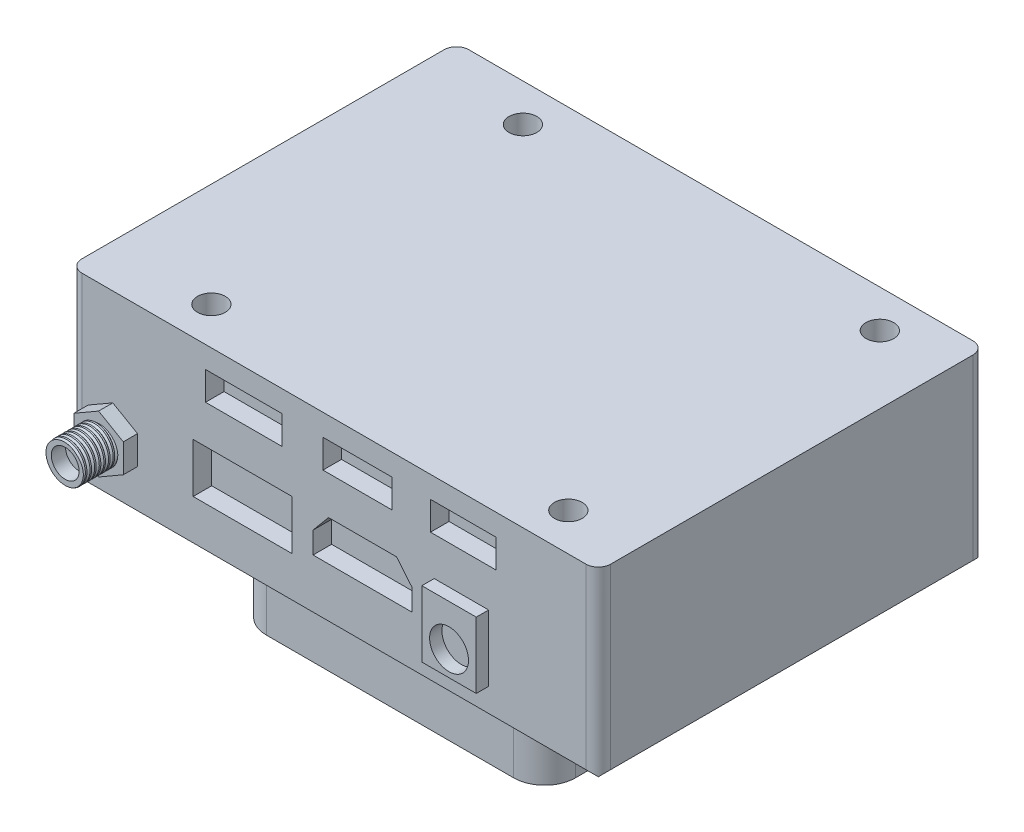
from build123d import *

# Parameters (mm, degrees)
SKETCH1_W           = 85.55
SKETCH1_H           = 62.6
BOSS_EXTRUDE1_DEPTH = 31.5
SKETCH2_R           = 2.25
CUT_EXTRUDE1_DEPTH  = 31.5
SKETCH3_W           = 16
SKETCH3_H           = 8
SKETCH3_W_2         = 12.4
SKETCH3_H_2         = 4.6
SKETCH3_W_3         = 11.2
SKETCH3_W_4         = 10.6
CUT_EXTRUDE2_DEPTH  = 3
SKETCH4_W           = 8.8
SKETCH4_H           = 10.7
SKETCH4_R           = 3.15
BOSS_EXTRUDE2_DEPTH = 2
BOSS_EXTRUDE3_DEPTH = 2.3
SKETCH6_R           = 3.11
BOSS_EXTRUDE4_DEPTH = 5.4
CUT_SWEEP1_PITCH    = 0.75
CUT_SWEEP1_FROM     = 0
SKETCH13_R          = 2.25
CUT_EXTRUDE3_DEPTH  = 2.3
CUT_EXTRUDE5_DEPTH  = 2.7
CHAMFER1_SIZE       = 2.7
CHAMFER3_SIZE       = 2.7
SKETCH15_R          = 1.75
CUT_EXTRUDE6_DEPTH  = 3
SKETCH17_R          = 3
SKETCH17_R_2        = 23.875
BOSS_EXTRUDE5_DEPTH = 10.6
BOSS_EXTRUDE6_DEPTH = 2
SKETCH21_W          = 11.7
SKETCH21_H          = 4.7
SKETCH21_W_2        = 9.3
SKETCH21_W_3        = 12.7
SKETCH21_H_2        = 2
CUT_EXTRUDE7_DEPTH  = 3
SKETCH22_W          = 10.7
SKETCH22_H          = 4.4
SKETCH22_W_2        = 8.1
CUT_EXTRUDE8_DEPTH  = 3
FILLET1_R           = 2


with BuildPart() as part:
    # Sketch1 → Boss-Extrude1 (new body)
    with BuildSketch(Plane(origin=(0, 0, 0), x_dir=(1, 0, 0), z_dir=(0, 1, 0))):
        Rectangle(SKETCH1_W, SKETCH1_H)
    extrude(amount=BOSS_EXTRUDE1_DEPTH)

    # Sketch2 → Cut-Extrude1 (cut)
    with BuildSketch(Plane(origin=(0, 31.5, 0), x_dir=(1, 0, 0), z_dir=(0, 1, 0))):
        with Locations(Location((-25.925, 25.2, 0), (0, 0, 270))):
            Circle(SKETCH2_R)
        with Locations(Location((31.825, 25.2, 0), (0, 0, 270))):
            Circle(SKETCH2_R)
        with Locations(Location((31.825, -25.2, 0), (0, 0, 270))):
            Circle(SKETCH2_R)
        with Locations(Location((-25.925, -25.2, 0), (0, 0, 270))):
            Circle(SKETCH2_R)
    extrude(amount=-CUT_EXTRUDE1_DEPTH, mode=Mode.SUBTRACT)

    # Sketch3 → Cut-Extrude2 (cut)
    with BuildSketch(Plane.XY.offset(31.3)):
        with Locations((-14.775, 13.2)):
            Rectangle(SKETCH3_W, SKETCH3_H)
        with Locations((-14.575, 25.7)):
            Rectangle(SKETCH3_W_2, SKETCH3_H_2)
        Polygon((-3.375, 10.7), (-3.375, 14.2), (-0.874607038, 17.2), (10.125392962, 17.2), (12.625, 14.2), (12.625, 10.7), align=None)
        with Locations((3.825, 25.7)):
            Rectangle(SKETCH3_W_3, SKETCH3_H_2)
        with Locations((20.925, 25.7)):
            Rectangle(SKETCH3_W_4, SKETCH3_H_2)
    extrude(amount=-CUT_EXTRUDE2_DEPTH, mode=Mode.SUBTRACT)

    # Sketch4 → Boss-Extrude2 (add)
    with BuildSketch(Plane.XY.offset(31.3)):
        with Locations((20.625, 11.85)):
            Rectangle(SKETCH4_W, SKETCH4_H)
        with Locations((20.625, 10.5)):
            Circle(SKETCH4_R, mode=Mode.SUBTRACT)
    extrude(amount=BOSS_EXTRUDE2_DEPTH)

    # Sketch5 → Boss-Extrude3 (add)
    with BuildSketch(Plane.XY.offset(31.3)):
        Polygon((-35.775, 6.581197846), (-31.775, 8.890598923), (-31.775, 13.509401077), (-35.775, 15.818802154), (-39.775, 13.509401077), (-39.775, 8.890598923), align=None)
    boss_extrude3 = extrude(amount=BOSS_EXTRUDE3_DEPTH)

    # Sketch6 → Boss-Extrude4 (add)
    with BuildSketch(Plane.XY.offset(33.6)):
        with Locations(Location((-35.775, 11.2, 0), (0, 0, 180))):
            Circle(SKETCH6_R)
    boss_extrude4 = extrude(amount=BOSS_EXTRUDE4_DEPTH)

    # Cut-Sweep1: arcs per turn and ends read off the stored shape
    # Cut-Sweep1: the profile of Sketch10 profile screwed along a left-hand helix through 10 turns, 8 arcs to a turn; built about Z, then put on its axis
    cut_sweep1_z = Axis((0, 0, 0), (0, 0, 1))
    cut_sweep1_corners = [(3.1103, 0, -0.75025), (3.1103, 0, -0.24975), (2.81, 0, -0.5)]
    with BuildLine(mode=Mode.PRIVATE) as cut_sweep1_profile:
        Line(cut_sweep1_corners[0], cut_sweep1_corners[1])
        Line(cut_sweep1_corners[1], cut_sweep1_corners[2])
        Line(cut_sweep1_corners[2], cut_sweep1_corners[0])
    cut_sweep1_cap = Face(cut_sweep1_profile.wire())
    cut_sweep1_turn_angles = [0, -22.5, -45, -67.5, -90, -112.5, -135, -157.5, -180, -202.5, -225, -247.5, -270, -292.5, -315, -337.5, -360]
    cut_sweep1_turn_weights = [1, 0.9238795325112867, 1, 0.9238795325112867, 1, 0.9238795325112867, 1, 0.9238795325112867, 1, 0.9238795325112867, 1, 0.9238795325112867, 1, 0.9238795325112867, 1, 0.9238795325112867, 1]
    cut_sweep1_turn_rails = [Edge.make_bspline([Vector(p[0], p[1], 0).rotate(cut_sweep1_z, cut_sweep1_turn_angles[k]) / cut_sweep1_turn_weights[k] + Vector(0, 0, p[2] + -CUT_SWEEP1_PITCH * cut_sweep1_turn_angles[k] / 360) for k in range(17)], [0, 0, 0, 1, 1, 2, 2, 3, 3, 4, 4, 5, 5, 6, 6, 7, 7, 8, 8, 8], 2, cut_sweep1_turn_weights) for p in cut_sweep1_corners]
    cut_sweep1_turn_sides = [Face.make_surface_from_curves(cut_sweep1_turn_rails[p[0]], cut_sweep1_turn_rails[p[1]]) for p in [(0, 1), (1, 2), (2, 0)]]
    cut_sweep1 = Plane(origin=(-35.775, 11.2, 33.6), x_dir=(1, 0, 0), z_dir=(0, 0, 1)) * split(Solid(Shell([*[p.moved(Location((0, 0, CUT_SWEEP1_PITCH * i))) for i in range(10) for p in cut_sweep1_turn_sides], cut_sweep1_cap, cut_sweep1_cap.rotate(cut_sweep1_z, -3600).moved(Location((0, 0, -CUT_SWEEP1_PITCH * -3600 / 360)))])), bisect_by=Plane.XY.offset(CUT_SWEEP1_FROM), keep=Keep.TOP, mode=Mode.PRIVATE)
    add(cut_sweep1, mode=Mode.SUBTRACT)

    # Sketch13 → Cut-Extrude3 (cut)
    with BuildSketch(Plane.XY.offset(39)):
        with Locations((-35.775, 11.2)):
            Circle(SKETCH13_R)
    cut_extrude3 = extrude(amount=-CUT_EXTRUDE3_DEPTH, mode=Mode.SUBTRACT)

    # Mirror1: Boss-Extrude3, Boss-Extrude4, Cut-Sweep1, Cut-Extrude3 across plane
    add(boss_extrude3.mirror(Plane.XY))
    add(boss_extrude4.mirror(Plane.XY))
    add(cut_sweep1.mirror(Plane.XY), mode=Mode.SUBTRACT)
    add(cut_extrude3.mirror(Plane.XY), mode=Mode.SUBTRACT)

    # Sketch14 → Cut-Extrude5 (cut)
    with BuildSketch(Plane.XZ):
        with BuildLine():
            Line((-36.175, 18), (-36.175, 24.7))
            Line((-36.175, 24.7), (-17.975, 24.7))
            Line((-17.975, 24.7), (-17.975, 22.99961536))
            ThreePointArc((-17.975, 22.99961536), (-16.975, 16.349999998), (-15.975, 22.99961536))
            Line((-15.975, 22.99961536), (-15.975, 24.7))
            Line((-15.975, 24.7), (21.525, 24.7))
            Line((21.525, 24.7), (21.525, 22.99961536))
            ThreePointArc((21.525, 22.99961536), (22.525, 16.349999998), (23.525, 22.99961536))
            Line((23.525, 22.99961536), (23.525, 24.7))
            Line((23.525, 24.7), (36.175, 24.7))
            Line((36.175, 24.7), (36.175, 19.5))
            Line((36.175, 19.5), (32.475, 19.5))
            ThreePointArc((32.475, 19.5), (30.353679656, 18.621320344), (29.475, 16.5))
            Line((29.475, 16.5), (29.475, -16.5))
            ThreePointArc((29.475, -16.5), (30.353679656, -18.621320344), (32.475, -19.5))
            Line((32.475, -19.5), (36.175, -19.5))
            Line((36.175, -19.5), (36.175, -24.7))
            Line((36.175, -24.7), (23.525, -24.7))
            Line((23.525, -24.7), (23.525, -22.999615364))
            ThreePointArc((23.525, -22.999615364), (22.525, -16.350000002), (21.525, -22.999615364))
            Line((21.525, -22.999615364), (21.525, -24.7))
            Line((21.525, -24.7), (-15.975, -24.7))
            Line((-15.975, -24.7), (-15.975, -22.999615364))
            ThreePointArc((-15.975, -22.999615364), (-16.975, -16.350000002), (-17.975, -22.999615364))
            Line((-17.975, -22.999615364), (-17.975, -24.7))
            Line((-17.975, -24.7), (-36.175, -24.7))
            Line((-36.175, -24.7), (-36.175, -18))
            Line((-36.175, -18), (-29.875, -18))
            ThreePointArc((-29.875, -18), (-27.753679656, -17.121320344), (-26.875, -15))
            Line((-26.875, -15), (-26.875, 15))
            ThreePointArc((-26.875, 15), (-27.753679656, 17.121320344), (-29.875, 18))
            Line((-29.875, 18), (-36.175, 18))
        make_face()
        with BuildLine():
            Line((-36.175, 16.5), (-36.175, 0.6))
            Line((-36.175, 0.6), (-28.875, 0.6))
            Line((-28.875, 0.6), (-28.875, 13.5))
            ThreePointArc((-28.875, 13.5), (-29.753679656, 15.621320344), (-31.875, 16.5))
            Line((-31.875, 16.5), (-36.175, 16.5))
        make_face()
        with BuildLine():
            Line((-36.175, -0.6), (-36.175, -16.5))
            Line((-36.175, -16.5), (-31.875, -16.5))
            ThreePointArc((-31.875, -16.5), (-29.753679656, -15.621320344), (-28.875, -13.5))
            Line((-28.875, -13.5), (-28.875, -0.6))
            Line((-28.875, -0.6), (-36.175, -0.6))
        make_face()
        with BuildLine():
            Line((36.175, 18), (33.975, 18))
            ThreePointArc((33.975, 18), (31.853679656, 17.121320344), (30.975, 15))
            Line((30.975, 15), (30.975, 0.6))
            Line((30.975, 0.6), (36.175, 0.6))
            Line((36.175, 0.6), (36.175, 18))
        make_face()
        with BuildLine():
            Line((36.175, -18), (33.975, -18))
            ThreePointArc((33.975, -18), (31.853679656, -17.121320344), (30.975, -15))
            Line((30.975, -15), (30.975, -0.6))
            Line((30.975, -0.6), (36.175, -0.6))
            Line((36.175, -0.6), (36.175, -18))
        make_face()
    extrude(amount=-CUT_EXTRUDE5_DEPTH, mode=Mode.SUBTRACT)

    # Chamfer1
    # the kernel refuses this chamfer: 4.080697596, 2.7, 2.255227871 mm, written as the material it adds along each edge
    with BuildSketch(Plane(origin=(-21.175197029, 2.7, -24.7), x_dir=(0, -1, 0), z_dir=(-1, 0, 0))) as chamfer1_piece_1_section:
        Polygon((CHAMFER1_SIZE, 0), (0, CHAMFER1_SIZE), (0, 0), align=None)
    chamfer1_piece_1 = extrude(amount=14.999802971, mode=Mode.PRIVATE)
    chamfer1_piece_1 = chamfer1_piece_1 - Plane(origin=(-25.925, 2.7, -25.2), x_dir=(0, 0, 1), z_dir=(0, 1, 0)) * Cylinder(2.25, 41, mode=Mode.PRIVATE)
    with BuildSketch(Plane(origin=(-11.031455932, 2.7, -24.7), x_dir=(0, -1, 0), z_dir=(-1, 0, 0))) as chamfer1_piece_2_section:
        Polygon((CHAMFER1_SIZE, 0), (0, CHAMFER1_SIZE), (0, 0), align=None)
    chamfer1_piece_2 = extrude(amount=19.643347038, mode=Mode.PRIVATE)
    chamfer1_piece_2 = chamfer1_piece_2 - Plane(origin=(-25.925, 2.7, -25.2), x_dir=(0, 0, 1), z_dir=(0, 1, 0)) * Cylinder(2.25, 51, mode=Mode.PRIVATE)
    with BuildSketch(Plane(origin=(36.574802971, 2.7, -24.7), x_dir=(0, -1, 0), z_dir=(-1, 0, 0))) as chamfer1_piece_3_section:
        Polygon((CHAMFER1_SIZE, 0), (0, CHAMFER1_SIZE), (0, 0), align=None)
    chamfer1_piece_3 = extrude(amount=19.993347038, mode=Mode.PRIVATE)
    chamfer1_piece_3 = chamfer1_piece_3 - Plane(origin=(31.825, 2.7, -25.2), x_dir=(0, 0, 1), z_dir=(0, 1, 0)) * Cylinder(2.25, 51, mode=Mode.PRIVATE)
    with BuildSketch(Plane(origin=(36.175, 2.7, -24.7), x_dir=(0, -1, 0), z_dir=(-1, 0, 0))) as chamfer1_piece_4_section:
        Polygon((CHAMFER1_SIZE, 0), (0, CHAMFER1_SIZE), (0, 0), align=None)
    chamfer1_piece_4 = extrude(amount=9.099802971, mode=Mode.PRIVATE)
    chamfer1_piece_4 = chamfer1_piece_4 - Plane(origin=(31.825, 2.7, -25.2), x_dir=(0, 0, 1), z_dir=(0, 1, 0)) * Cylinder(2.25, 29, mode=Mode.PRIVATE)
    with BuildSketch(Plane(origin=(36.175, -6.943544068, -24.7), x_dir=(-1, 0, 0), z_dir=(0, 1, 0))) as chamfer1_piece_5_section:
        Polygon((CHAMFER1_SIZE, 0), (0, CHAMFER1_SIZE), (0, 0), align=None)
    chamfer1_piece_5 = extrude(amount=16.587088135, mode=Mode.PRIVATE)
    chamfer1_piece_5 = chamfer1_piece_5 - Plane(origin=(31.825, -6.943544068, -25.2), x_dir=(0, 0, 1), z_dir=(0, 1, 0)) * Cylinder(2.25, 44, mode=Mode.PRIVATE)
    chamfer1_piece_5 = split(chamfer1_piece_5, bisect_by=Plane(origin=(36.175, -3.471772034, -28.171772034), z_dir=(0, 0.7071067811865475, -0.7071067811865477)), keep=Keep.TOP, mode=Mode.PRIVATE)
    with BuildSketch(Plane(origin=(27.075197029, 2.7, 24.7), x_dir=(0, -1, 0), z_dir=(1, 0, 0))) as chamfer1_piece_6_section:
        Polygon((CHAMFER1_SIZE, 0), (0, CHAMFER1_SIZE), (0, 0), align=None)
    chamfer1_piece_6 = extrude(amount=9.099802971, mode=Mode.PRIVATE)
    chamfer1_piece_6 = chamfer1_piece_6 - Plane(origin=(31.825, 2.7, 25.2), x_dir=(0, 0, 1), z_dir=(0, 1, 0)) * Cylinder(2.25, 29, mode=Mode.PRIVATE)
    with BuildSketch(Plane(origin=(16.581455932, 2.7, 24.7), x_dir=(0, -1, 0), z_dir=(1, 0, 0))) as chamfer1_piece_7_section:
        Polygon((CHAMFER1_SIZE, 0), (0, CHAMFER1_SIZE), (0, 0), align=None)
    chamfer1_piece_7 = extrude(amount=19.993347038, mode=Mode.PRIVATE)
    chamfer1_piece_7 = chamfer1_piece_7 - Plane(origin=(31.825, 2.7, 25.2), x_dir=(0, 0, 1), z_dir=(0, 1, 0)) * Cylinder(2.25, 51, mode=Mode.PRIVATE)
    with BuildSketch(Plane(origin=(-30.674802971, 2.7, 24.7), x_dir=(0, -1, 0), z_dir=(1, 0, 0))) as chamfer1_piece_8_section:
        Polygon((CHAMFER1_SIZE, 0), (0, CHAMFER1_SIZE), (0, 0), align=None)
    chamfer1_piece_8 = extrude(amount=19.643347038, mode=Mode.PRIVATE)
    chamfer1_piece_8 = chamfer1_piece_8 - Plane(origin=(-25.925, 2.7, 25.2), x_dir=(0, 0, 1), z_dir=(0, 1, 0)) * Cylinder(2.25, 51, mode=Mode.PRIVATE)
    with BuildSketch(Plane(origin=(-36.175, 2.7, 24.7), x_dir=(0, -1, 0), z_dir=(1, 0, 0))) as chamfer1_piece_9_section:
        Polygon((CHAMFER1_SIZE, 0), (0, CHAMFER1_SIZE), (0, 0), align=None)
    chamfer1_piece_9 = extrude(amount=14.999802971, mode=Mode.PRIVATE)
    chamfer1_piece_9 = chamfer1_piece_9 - Plane(origin=(-25.925, 2.7, 25.2), x_dir=(0, 0, 1), z_dir=(0, 1, 0)) * Cylinder(2.25, 41, mode=Mode.PRIVATE)
    with BuildSketch(Plane(origin=(-36.175, -6.943544068, 24.7), x_dir=(1, 0, 0), z_dir=(0, 1, 0))) as chamfer1_piece_10_section:
        Polygon((CHAMFER1_SIZE, 0), (0, CHAMFER1_SIZE), (0, 0), align=None)
    chamfer1_piece_10 = extrude(amount=16.587088135, mode=Mode.PRIVATE)
    chamfer1_piece_10 = split(chamfer1_piece_10, bisect_by=Plane(origin=(-36.175, -3.471772034, 28.171772034), z_dir=(0, 0.7071067811865475, 0.7071067811865477)), keep=Keep.TOP, mode=Mode.PRIVATE)
    with BuildSketch(Plane(origin=(36.175, -6.943544068, 24.7), x_dir=(0, 0, -1), z_dir=(0, 1, 0))) as chamfer1_piece_11_section:
        Polygon((CHAMFER1_SIZE, 0), (0, CHAMFER1_SIZE), (0, 0), align=None)
    chamfer1_piece_11 = extrude(amount=16.587088135, mode=Mode.PRIVATE)
    chamfer1_piece_11 = chamfer1_piece_11 - Plane(origin=(31.825, -6.943544068, 25.2), x_dir=(0, 0, 1), z_dir=(0, 1, 0)) * Cylinder(2.25, 44, mode=Mode.PRIVATE)
    chamfer1_piece_11 = split(chamfer1_piece_11, bisect_by=Plane(origin=(36.175, -3.471772034, 28.171772034), z_dir=(0, 0.7071067811865475, 0.7071067811865477)), keep=Keep.TOP, mode=Mode.PRIVATE)
    with BuildSketch(Plane(origin=(28.468544068, 2.7, -24.7), x_dir=(0, -1, 0), z_dir=(-1, 0, 0)), Plane(origin=(-22.918544068, 2.7, 24.7), x_dir=(0, -1, 0), z_dir=(1, 0, 0))) as chamfer1_piece_12:
        Polygon((CHAMFER1_SIZE, 0), (0, CHAMFER1_SIZE), (0, 0), align=None)
    chamfer1_piece_12_solid = extrude(amount=51.387088135, mode=Mode.PRIVATE)
    with BuildSketch(Plane(origin=(-36.175, -6.943544068, -24.7), x_dir=(0, 0, 1), z_dir=(0, 1, 0))) as chamfer1_piece_13_section:
        Polygon((CHAMFER1_SIZE, 0), (0, CHAMFER1_SIZE), (0, 0), align=None)
    chamfer1_piece_13 = extrude(amount=16.587088135, mode=Mode.PRIVATE)
    chamfer1_piece_13 = split(chamfer1_piece_13, bisect_by=Plane(origin=(-36.175, -3.471772034, -28.171772034), z_dir=(0, 0.7071067811865475, -0.7071067811865477)), keep=Keep.TOP, mode=Mode.PRIVATE)
    add([chamfer1_piece_1, chamfer1_piece_2, chamfer1_piece_3, chamfer1_piece_4, chamfer1_piece_5, chamfer1_piece_6, chamfer1_piece_7, chamfer1_piece_8, chamfer1_piece_9, chamfer1_piece_10, chamfer1_piece_11, chamfer1_piece_12_solid, chamfer1_piece_13])
    # the kernel refuses this chamfer: 4.080697596, 2.7, 2.255227871 mm, written as the material it adds along each edge
    with BuildSketch(Plane(origin=(22.525, 2.7, 19.749999998), x_dir=(-0.003141587485880306, 0, 0.9999950652018581), z_dir=(0.9999950652018581, 0, 0.003141587485880306))) as chamfer1_2_piece_1:
        Polygon((3.4, CHAMFER1_SIZE), (3.4 + CHAMFER1_SIZE, 0), (3.4, 0), align=None)
    chamfer1_2_piece_1_solid = revolve(axis=Axis((22.525, 2.7, 19.749999998), (0, -1, 0)), revolution_arc=359.64, mode=Mode.PRIVATE)
    with BuildSketch(Plane(origin=(22.525, 2.7, -19.750000002), x_dir=(0.003141587485879258, 0, -0.9999950652018582), z_dir=(-0.9999950652018582, 0, -0.003141587485879258))) as chamfer1_2_piece_2:
        Polygon((3.4, CHAMFER1_SIZE), (3.4 + CHAMFER1_SIZE, 0), (3.4, 0), align=None)
    chamfer1_2_piece_2_solid = revolve(axis=Axis((22.525, 2.7, -19.750000002), (0, -1, 0)), revolution_arc=359.64, mode=Mode.PRIVATE)
    with BuildSketch(Plane(origin=(-16.975, 2.7, -19.750000002), x_dir=(0.003141587485879258, 0, -0.9999950652018582), z_dir=(-0.9999950652018582, 0, -0.003141587485879258))) as chamfer1_2_piece_3:
        Polygon((3.4, CHAMFER1_SIZE), (3.4 + CHAMFER1_SIZE, 0), (3.4, 0), align=None)
    chamfer1_2_piece_3_solid = revolve(axis=Axis((-16.975, 2.7, -19.750000002), (0, -1, 0)), revolution_arc=359.64, mode=Mode.PRIVATE)
    with BuildSketch(Plane(origin=(-16.975, 2.7, 19.749999998), x_dir=(-0.003141587485880306, 0, 0.9999950652018581), z_dir=(0.9999950652018581, 0, 0.003141587485880306))) as chamfer1_2_piece_4:
        Polygon((3.4, CHAMFER1_SIZE), (3.4 + CHAMFER1_SIZE, 0), (3.4, 0), align=None)
    chamfer1_2_piece_4_solid = revolve(axis=Axis((-16.975, 2.7, 19.749999998), (0, -1, 0)), revolution_arc=359.64, mode=Mode.PRIVATE)
    add([chamfer1_2_piece_1_solid, chamfer1_2_piece_2_solid, chamfer1_2_piece_3_solid, chamfer1_2_piece_4_solid])

    # Chamfer3
    # the kernel refuses this chamfer: 2.7 mm, written as the material it adds along each edge
    with BuildSketch(Plane(origin=(32.475, 2.7, -19.5), x_dir=(0, 0, -1), z_dir=(1, 0, 0))) as chamfer3_piece_1_section:
        Polygon((CHAMFER3_SIZE, 0), (0, -CHAMFER3_SIZE), (0, 0), align=None)
    chamfer3_piece_1 = extrude(amount=10.643544068, mode=Mode.PRIVATE)
    chamfer3_piece_1 = split(chamfer3_piece_1, bisect_by=Plane(origin=(42.775, 2.7, -19.5), z_dir=(-1, 0, 0)), keep=Keep.TOP, mode=Mode.PRIVATE)
    add(chamfer3_piece_1)
    with BuildSketch(Plane(origin=(43.118544068, 2.7, 19.5), x_dir=(0, 0, 1), z_dir=(-1, 0, 0))) as chamfer3_piece_2_section:
        Polygon((CHAMFER3_SIZE, 0), (0, -CHAMFER3_SIZE), (0, 0), align=None)
    chamfer3_piece_2 = extrude(amount=10.643544068, mode=Mode.PRIVATE)
    chamfer3_piece_2 = split(chamfer3_piece_2, bisect_by=Plane(origin=(42.775, 2.7, 19.5), z_dir=(-1, 0, 0)), keep=Keep.TOP, mode=Mode.PRIVATE)
    add(chamfer3_piece_2)
    with BuildSketch(Plane(origin=(32.475, 2.7, -16.5), x_dir=(-1, 0, 0), z_dir=(0, 0, 1))) as chamfer3_piece_3:
        Polygon((3 + CHAMFER3_SIZE, 0), (3, CHAMFER3_SIZE), (3, 0), align=None)
    revolve(axis=Axis((32.475, 2.7, -16.5), (0, -1, 0)), revolution_arc=90)
    with BuildSketch(Plane(origin=(32.475, 2.7, 16.5), x_dir=(0, 0, 1), z_dir=(1, 0, 0))) as chamfer3_piece_4:
        Polygon((3 + CHAMFER3_SIZE, 0), (3, CHAMFER3_SIZE), (3, 0), align=None)
    revolve(axis=Axis((32.475, 2.7, 16.5), (0, -1, 0)), revolution_arc=90)
    with BuildSketch(Plane(origin=(29.475, 2.7, 16.5), x_dir=(-1, 0, 0), z_dir=(0, 0, -1))) as chamfer3_piece_5:
        Polygon((CHAMFER3_SIZE, 0), (0, -CHAMFER3_SIZE), (0, 0), align=None)
    extrude(amount=33)
    with BuildSketch(Plane(origin=(-36.175, 2.7, -28.943544068), x_dir=(1, 0, 0), z_dir=(0, 0, 1))) as chamfer3_piece_6_section:
        Polygon((CHAMFER3_SIZE, 0), (0, -CHAMFER3_SIZE), (0, 0), align=None)
    chamfer3_piece_6 = extrude(amount=17.887088135, mode=Mode.PRIVATE)
    chamfer3_piece_6 = split(chamfer3_piece_6, bisect_by=Plane(origin=(-36.175, 2.7, -16.5), z_dir=(0, 0, -1)), keep=Keep.TOP, mode=Mode.PRIVATE)
    add(chamfer3_piece_6)
    with BuildSketch(Plane(origin=(-36.175, 2.7, 11.056455932), x_dir=(1, 0, 0), z_dir=(0, 0, 1))) as chamfer3_piece_7_section:
        Polygon((CHAMFER3_SIZE, 0), (0, -CHAMFER3_SIZE), (0, 0), align=None)
    chamfer3_piece_7 = extrude(amount=17.887088135, mode=Mode.PRIVATE)
    chamfer3_piece_7 = split(chamfer3_piece_7, bisect_by=Plane(origin=(-36.175, 2.7, 16.5), z_dir=(0, 0, 1)), keep=Keep.TOP, mode=Mode.PRIVATE)
    add(chamfer3_piece_7)
    with BuildSketch(Plane(origin=(-29.875, 2.7, 18), x_dir=(0, 0, 1), z_dir=(-1, 0, 0))) as chamfer3_piece_8_section:
        Polygon((CHAMFER3_SIZE, 0), (0, -CHAMFER3_SIZE), (0, 0), align=None)
    chamfer3_piece_8 = extrude(amount=13.243544068, mode=Mode.PRIVATE)
    chamfer3_piece_8 = split(chamfer3_piece_8, bisect_by=Plane(origin=(-42.775, 2.7, 18), z_dir=(1, 0, 0)), keep=Keep.TOP, mode=Mode.PRIVATE)
    add(chamfer3_piece_8)
    with BuildSketch(Plane(origin=(-43.118544068, 2.7, -18), x_dir=(0, 0, -1), z_dir=(1, 0, 0))) as chamfer3_piece_9_section:
        Polygon((CHAMFER3_SIZE, 0), (0, -CHAMFER3_SIZE), (0, 0), align=None)
    chamfer3_piece_9 = extrude(amount=13.243544068, mode=Mode.PRIVATE)
    chamfer3_piece_9 = split(chamfer3_piece_9, bisect_by=Plane(origin=(-42.775, 2.7, -18), z_dir=(1, 0, 0)), keep=Keep.TOP, mode=Mode.PRIVATE)
    add(chamfer3_piece_9)
    with BuildSketch(Plane(origin=(-29.875, 2.7, 15), x_dir=(1, 0, 0), z_dir=(0, 0, -1))) as chamfer3_piece_10:
        Polygon((3 + CHAMFER3_SIZE, 0), (3, CHAMFER3_SIZE), (3, 0), align=None)
    revolve(axis=Axis((-29.875, 2.7, 15), (0, -1, 0)), revolution_arc=90)
    with BuildSketch(Plane(origin=(-29.875, 2.7, -15), x_dir=(0, 0, -1), z_dir=(-1, 0, 0))) as chamfer3_piece_11:
        Polygon((3 + CHAMFER3_SIZE, 0), (3, CHAMFER3_SIZE), (3, 0), align=None)
    revolve(axis=Axis((-29.875, 2.7, -15), (0, -1, 0)), revolution_arc=90)
    with BuildSketch(Plane(origin=(-26.875, 2.7, -15), x_dir=(1, 0, 0), z_dir=(0, 0, 1))) as chamfer3_piece_12:
        Polygon((CHAMFER3_SIZE, 0), (0, -CHAMFER3_SIZE), (0, 0), align=None)
    extrude(amount=30)
    # the kernel refuses this chamfer: 2.7 mm, written as the material it takes off along each edge
    with BuildSketch(Plane(origin=(42.775, 0, -38.243544068), x_dir=(-1, 0, 0), z_dir=(0, 0, 1)), Plane(origin=(-42.775, 0, 38.243544068), x_dir=(1, 0, 0), z_dir=(0, 0, -1))) as chamfer3_2_piece_1:
        Polygon((CHAMFER3_SIZE, 0), (0, -CHAMFER3_SIZE), (0, 0), align=None)
    extrude(amount=76.487088135, mode=Mode.SUBTRACT)
    with BuildSketch(Plane(origin=(-49.718544068, 0, -31.3), x_dir=(0, 0, 1), z_dir=(1, 0, 0)), Plane(origin=(49.718544068, 0, 31.3), x_dir=(0, 0, -1), z_dir=(-1, 0, 0))) as chamfer3_2_piece_2:
        Polygon((CHAMFER3_SIZE, 0), (0, -CHAMFER3_SIZE), (0, 0), align=None)
    extrude(amount=99.437088135, mode=Mode.SUBTRACT)

    # Sketch15 → Cut-Extrude6 (cut)
    with BuildSketch(Plane.XZ):
        with Locations(Location((-16.975, 19.749999998, 0), (0, 0, 270))):
            Circle(SKETCH15_R)
        with Locations(Location((22.525, 19.749999998, 0), (0, 0, 270))):
            Circle(SKETCH15_R)
        with Locations(Location((-16.975, -19.750000002, 0), (0, 0, 270))):
            Circle(SKETCH15_R)
        with Locations(Location((22.525, -19.750000002, 0), (0, 0, 270))):
            Circle(SKETCH15_R)
    extrude(amount=-CUT_EXTRUDE6_DEPTH, mode=Mode.SUBTRACT)

    # Sketch17 → Boss-Extrude5 (add)
    with BuildSketch(Plane(origin=(0, 0, 0), x_dir=(-1, 0, 0), z_dir=(0, -1, 0))):
        with BuildLine():
            Line((17.22, -25), (-22.78, -25))
            ThreePointArc((-22.78, -25), (-26.315533906, -23.535533906), (-27.78, -20))
            Line((-27.78, -20), (-27.78, 20))
            ThreePointArc((-27.78, 20), (-26.315533906, 23.535533906), (-22.78, 25))
            Line((-22.78, 25), (17.22, 25))
            ThreePointArc((17.22, 25), (20.755533906, 23.535533906), (22.22, 20))
            Line((22.22, 20), (22.22, -20))
            ThreePointArc((22.22, -20), (20.755533906, -23.535533906), (17.22, -25))
        make_face()
        with Locations(Location((16.975, -19.749999998, 0), (0, 0, 90))):
            Circle(SKETCH17_R, mode=Mode.SUBTRACT)
        with Locations(Location((-22.525, -19.749999998, 0), (0, 0, 90))):
            Circle(SKETCH17_R, mode=Mode.SUBTRACT)
        with Locations(Location((16.975, 19.750000002, 0), (0, 0, 90))):
            Circle(SKETCH17_R, mode=Mode.SUBTRACT)
        with Locations(Location((-22.525, 19.750000002, 0), (0, 0, 90))):
            Circle(SKETCH17_R, mode=Mode.SUBTRACT)
        with Locations(Location((-2.78, 0, 0), (0, 0, 90))):
            Circle(SKETCH17_R_2, mode=Mode.SUBTRACT)
    extrude(amount=BOSS_EXTRUDE5_DEPTH)

    # Sketch18 → Boss-Extrude6 (add)
    with BuildSketch(Plane.XZ):
        with BuildLine():
            Line((0.28, 4.330127019), (0.28, 25))
            Line((0.28, 25), (5.28, 25))
            Line((5.28, 25), (5.28, 4.330127019))
            ThreePointArc((5.28, 4.330127019), (7.110127019, 2.5), (7.78, 0))
            Line((7.78, 0), (25.680635095, -10.334936491))
            Line((25.680635095, -10.334936491), (23.180635095, -14.665063509))
            Line((23.180635095, -14.665063509), (5.28, -4.330127019))
            ThreePointArc((5.28, -4.330127019), (2.78, -5), (0.28, -4.330127019))
            Line((0.28, -4.330127019), (-17.620635095, -14.665063509))
            Line((-17.620635095, -14.665063509), (-20.120635095, -10.334936491))
            Line((-20.120635095, -10.334936491), (-2.22, 0))
            ThreePointArc((-2.22, 0), (-1.550127019, 2.5), (0.28, 4.330127019))
        make_face()
    extrude(amount=BOSS_EXTRUDE6_DEPTH)

    # Sketch21 → Cut-Extrude7 (cut)
    with BuildSketch(Plane.ZY.offset(42.775)):
        with Locations((15.95, 25.55)):
            Rectangle(SKETCH21_W, SKETCH21_H)
        with Locations((1.95, 25.55)):
            Rectangle(SKETCH21_W_2, SKETCH21_H)
        with Locations((-11.65, 26.9)):
            Rectangle(SKETCH21_W_3, SKETCH21_H_2)
    extrude(amount=-CUT_EXTRUDE7_DEPTH, mode=Mode.SUBTRACT)

    # Sketch22 → Cut-Extrude8 (cut)
    with BuildSketch(Plane(origin=(0, 0, -31.3), x_dir=(-1, 0, 0), z_dir=(0, 0, -1))):
        with Locations((-22.825, 25.8)):
            Rectangle(SKETCH22_W, SKETCH22_H)
        with Locations((-10.625, 25.8)):
            Rectangle(SKETCH22_W_2, SKETCH22_H)
        with BuildLine():
            Line((-26.325, 14.1), (-9.525, 14.1))
            ThreePointArc((-9.525, 14.1), (-7.675, 12.25), (-9.525, 10.4))
            Line((-9.525, 10.4), (-26.325, 10.4))
            ThreePointArc((-26.325, 10.4), (-28.175, 12.25), (-26.325, 14.1))
        make_face()
        with BuildLine():
            Line((6.725, 14.1), (23.525, 14.1))
            ThreePointArc((23.525, 14.1), (25.375, 12.25), (23.525, 10.4))
            Line((23.525, 10.4), (6.725, 10.4))
            ThreePointArc((6.725, 10.4), (4.875, 12.25), (6.725, 14.1))
        make_face()
    extrude(amount=-CUT_EXTRUDE8_DEPTH, mode=Mode.SUBTRACT)

    # Fillet1
    fillet1_edges = [part.edges().sort_by_distance(p)[0] for p in [
        (42.775, 17.1, 31.3),
        (-42.775, 17.1, 31.3),
        (-42.775, 17.1, -31.3),
        (42.775, 17.1, -31.3),
    ]]
    fillet(fillet1_edges, radius=FILLET1_R)


solid = part.part
